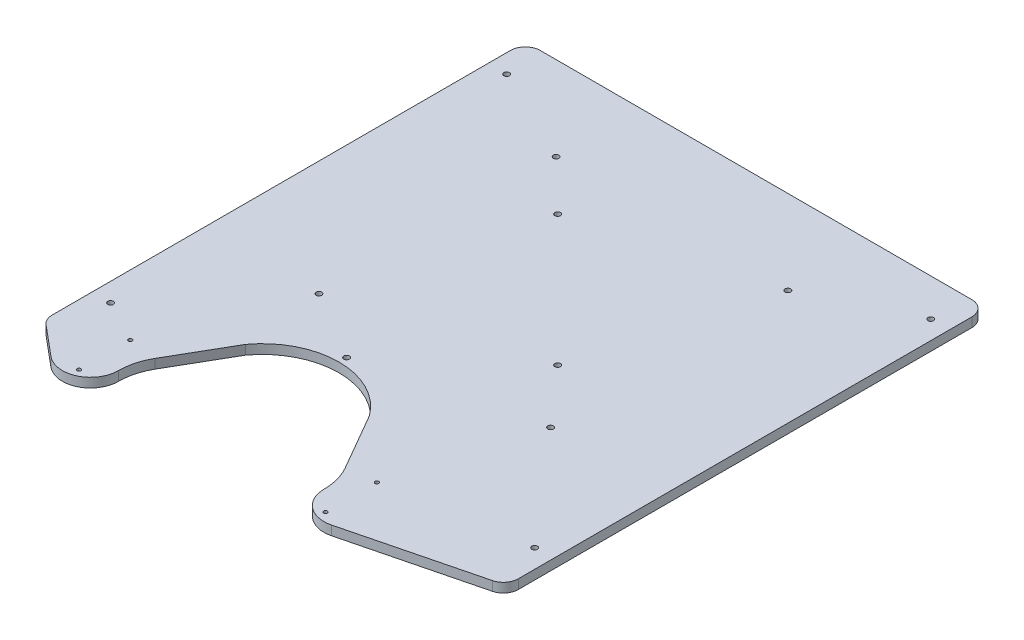
from build123d import *

# Parameters (mm, degrees)
ESQUISSE1_R             = 1
BOSS_EXTRU_1_DEPTH      = 5
ESQUISSE2_R             = 1.5
ENL_V_MAT_EXTRU_1_DEPTH = 275.48654739
ESQUISSE3_R             = 1.5
ENL_V_MAT_EXTRU_2_DEPTH = 275.48654739
ESQUISSE4_R             = 1.5
ENL_V_MAT_EXTRU_3_DEPTH = 275.48654739


with BuildPart() as part:
    # Esquisse1 → Boss.-Extru.1 (new body)
    with BuildSketch(Plane(origin=(0, 0, 0), x_dir=(1, 0, 0), z_dir=(0, 1, 0))):
        with BuildLine():
            Line((-115.5, 31.2), (115.5, 31.2))
            ThreePointArc((115.5, 31.2), (121.156854249, 28.856854249), (123.5, 23.2))
            Line((123.5, 23.2), (123.5, -219.563455357))
            ThreePointArc((123.5, -219.563455357), (121.809339782, -224.482015259), (117.451942122, -227.321671773))
            Line((117.451942122, -227.321671773), (48.659891479, -244.629528902))
            ThreePointArc((48.659891479, -244.629528902), (45.510605443, -245.074180006), (42.33836323, -244.8448408))
            ThreePointArc((42.33836323, -244.8448408), (33.490774319, -239.702526143), (30, -230.082873123))
            ThreePointArc((30, -230.082873123), (28.945508514, -222.073215083), (25.853895909, -214.609402001))
            Line((25.853895909, -214.609402001), (10.681549424, -188.330127019))
            Line((10.681549424, -188.330127019), (8.181549424, -184))
            ThreePointArc((8.181549424, -184), (-25, -167.082873123), (-58.181549424, -184))
            Line((-58.181549424, -184), (-60.681549424, -188.330127019))
            Line((-60.681549424, -188.330127019), (-75.853895909, -214.609402001))
            ThreePointArc((-75.853895909, -214.609402001), (-78.945508514, -222.073215083), (-80, -230.082873123))
            ThreePointArc((-80, -230.082873123), (-81.87001368, -237.335697347), (-87.013794564, -242.780137503))
            ThreePointArc((-87.013794564, -242.780137503), (-96.012583909, -245.048656558), (-104.623781388, -241.588646969))
            Line((-104.623781388, -241.588646969), (-120.632683407, -228.198311355))
            ThreePointArc((-120.632683407, -228.198311355), (-122.747808885, -225.448529171), (-123.5, -222.061898637))
            Line((-123.5, -222.061898637), (-123.5, 23.2))
            ThreePointArc((-123.5, 23.2), (-121.156854249, 28.856854249), (-115.5, 31.2))
        make_face()
        with Locations((41, -212.75)):
            Circle(ESQUISSE1_R, mode=Mode.SUBTRACT)
        with Locations((41, -240.25)):
            Circle(ESQUISSE1_R, mode=Mode.SUBTRACT)
        with Locations((-91, -212.75)):
            Circle(ESQUISSE1_R, mode=Mode.SUBTRACT)
        with Locations((-91, -240.25)):
            Circle(ESQUISSE1_R, mode=Mode.SUBTRACT)
    extrude(amount=-BOSS_EXTRU_1_DEPTH)

    # Esquisse2 → Enlèv. mat.-Extru.1 (cut, through all)
    with BuildSketch(Plane(origin=(0, 0, 0), x_dir=(1, 0, 0), z_dir=(0, 1, 0))):
        with Locations((-113.5, 11.2)):
            Circle(ESQUISSE2_R)
        with Locations((-25, -163)):
            Circle(ESQUISSE2_R)
        with Locations((113.5, 11.2)):
            Circle(ESQUISSE2_R)
        with Locations((113.5, -200.8)):
            Circle(ESQUISSE2_R)
        with Locations((-113.5, -200.8)):
            Circle(ESQUISSE2_R)
    extrude(amount=-ENL_V_MAT_EXTRU_1_DEPTH, mode=Mode.SUBTRACT)

    # Esquisse3 → Enlèv. mat.-Extru.2 (cut, through all)
    with BuildSketch(Plane(origin=(0, 0, 0), x_dir=(1, 0, 0), z_dir=(0, 1, 0))):
        with Locations((62, -140.8)):
            Circle(ESQUISSE3_R)
        with Locations((-62, -140.8)):
            Circle(ESQUISSE3_R)
        with Locations((62, -13.8)):
            Circle(ESQUISSE3_R)
        with Locations((-62, -13.8)):
            Circle(ESQUISSE3_R)
    extrude(amount=-ENL_V_MAT_EXTRU_2_DEPTH, mode=Mode.SUBTRACT)

    # Esquisse4 → Enlèv. mat.-Extru.3 (cut, through all)
    with BuildSketch(Plane(origin=(0, 0, 0), x_dir=(1, 0, 0), z_dir=(0, 1, 0))):
        with Locations((-35, -40)):
            Circle(ESQUISSE4_R)
        with Locations((35, -110)):
            Circle(ESQUISSE4_R)
    extrude(amount=-ENL_V_MAT_EXTRU_3_DEPTH, mode=Mode.SUBTRACT)


solid = part.part
